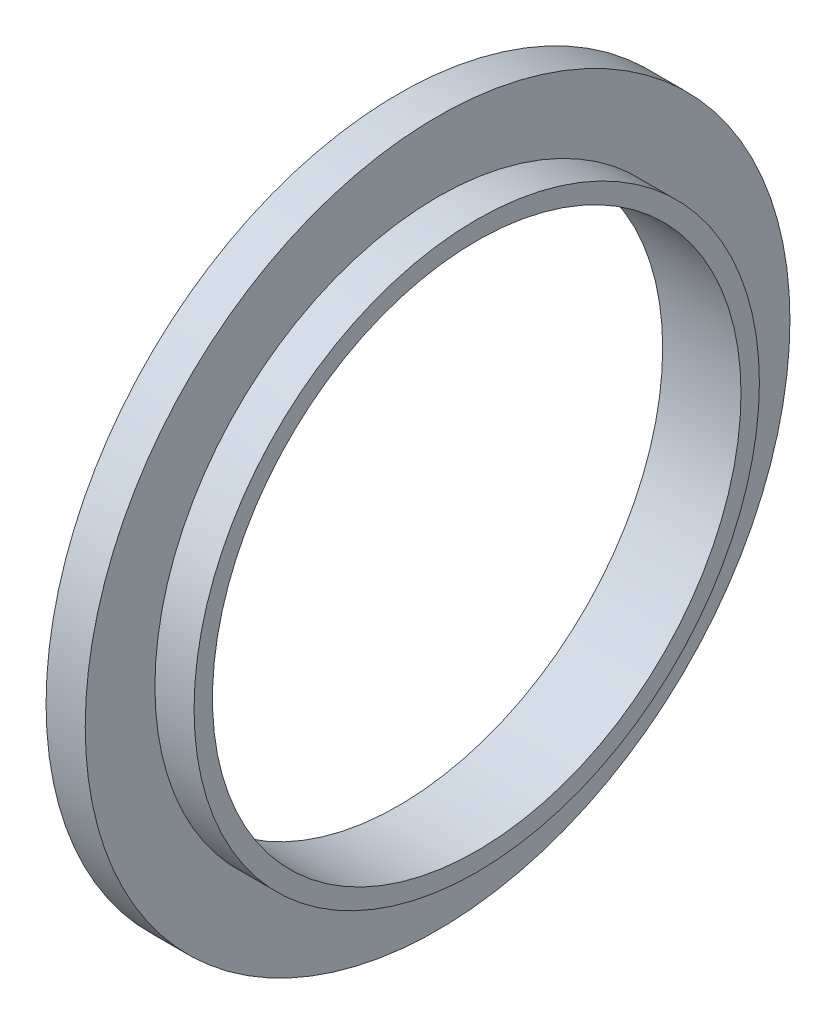
from build123d import *

# Parameters (mm, degrees)
SKETCH1_R           = 57.15
SKETCH1_R_2         = 42.8625
BOSS_EXTRUDE1_DEPTH = 6.35
SKETCH2_R           = 45.847
SKETCH2_R_2         = 42.8625
BOSS_EXTRUDE2_DEPTH = 6.35


with BuildPart() as part:
    # Sketch1 → Boss-Extrude1 (new body)
    with BuildSketch(Plane(origin=(0, 0, 0), x_dir=(0, 0, -1), z_dir=(1, 0, 0))):
        Circle(SKETCH1_R)
        Circle(SKETCH1_R_2, mode=Mode.SUBTRACT)
    extrude(amount=BOSS_EXTRUDE1_DEPTH)

    # Sketch2 → Boss-Extrude2 (add)
    with BuildSketch(Plane(origin=(6.35, 0, 0), x_dir=(0, 0, -1), z_dir=(1, 0, 0))):
        Circle(SKETCH2_R)
        Circle(SKETCH2_R_2, mode=Mode.SUBTRACT)
    extrude(amount=BOSS_EXTRUDE2_DEPTH)


solid = part.part
